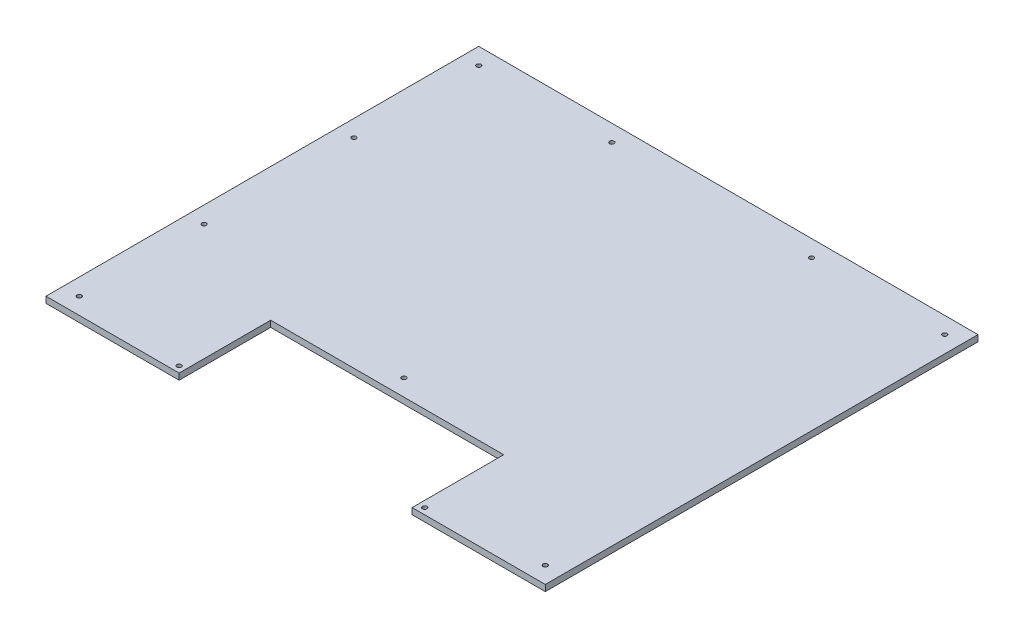
from build123d import *

# Parameters (mm, degrees)
BOSS_EXTRUDE1_DEPTH  = 4.7625
M3_CLEARANCE_HOLE1_D = 3.4


with BuildPart() as part:
    # Sketch1 → Boss-Extrude1 (new body)
    with BuildSketch(Plane(origin=(0, 0, 0), x_dir=(1, 0, 0), z_dir=(0, 1, 0))):
        Polygon((-190.5, -165.1), (-88.9, -165.1), (-88.9, -95.25), (88.9, -95.25), (88.9, -165.1), (190.5, -165.1), (190.5, 165.1), (-190.5, 165.1), align=None)
    extrude(amount=BOSS_EXTRUDE1_DEPTH)

    # M3 Clearance Hole1 (through all)
    with Locations(Plane(origin=(-76.2, 4.7625, -152.4), x_dir=(0, 0, 1), z_dir=(0, 1, 0))):
        with Locations((0, 0), (0, 152.4), (234.95, 76.2), (312.7248, -17.4752), (304.8, -101.6), (0, -101.6), (0, 254), (304.8, 254), (312.7248, 169.8752), (95.25, -101.6), (209.55, -101.6)):
            Hole(M3_CLEARANCE_HOLE1_D / 2)


solid = part.part
